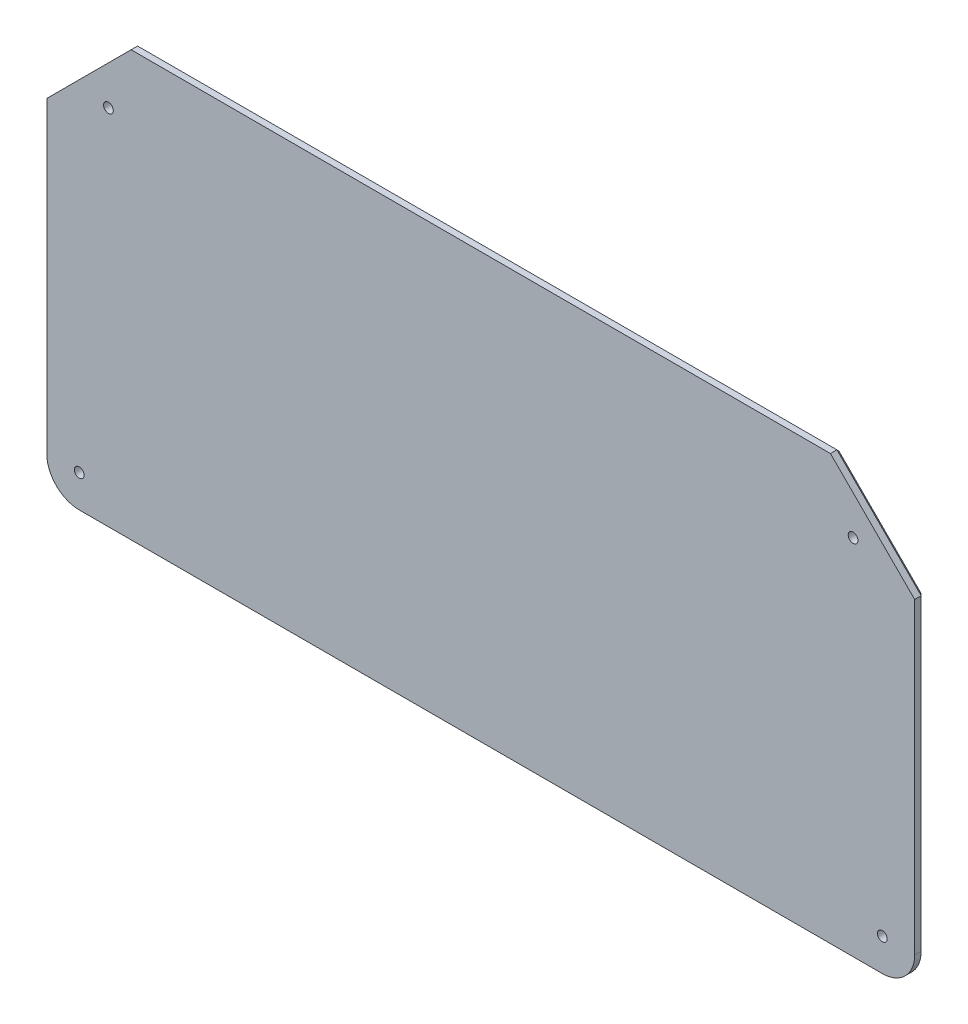
from build123d import *

# Parameters (mm, degrees)
BOSS_EXTRUDE1_DEPTH   = 3
F_3_0MM_DOWEL_HOLE1_D = 3
CHAMFER1_SIZE         = 1


with BuildPart() as part:
    # Sketch2 → Boss-Extrude1 (new body)
    with BuildSketch(Plane.XY):
        with BuildLine():
            Line((6.41186441, 110.238694526), (6.41186441, 15.286374556))
            ThreePointArc((6.41186441, 15.286374556), (9.340796598, 8.215306744), (16.41186441, 5.286374556))
            Line((16.41186441, 5.286374556), (264.168886442, 5.286374556))
            ThreePointArc((264.168886442, 5.286374556), (271.239954254, 8.215306744), (274.168886442, 15.286374556))
            Line((274.168886442, 15.286374556), (274.168886442, 110.238694526))
            Line((274.168886442, 110.238694526), (248.168886442, 136.238694526))
            Line((248.168886442, 136.238694526), (32.41186441, 136.238694526))
            Line((32.41186441, 136.238694526), (6.41186441, 110.238694526))
        make_face()
    extrude(amount=-BOSS_EXTRUDE1_DEPTH)

    # Ø3.0mm Dowel Hole1 (through all)
    with Locations(Plane.XY):
        with Locations((16.41186441, 15.286374556), (25.42227205, 117.228286886), (255.158478802, 117.228286886), (264.168886442, 15.286374556)):
            Hole(F_3_0MM_DOWEL_HOLE1_D / 2)

    # Chamfer1
    chamfer1_edges = [part.edges().sort_by_distance(p)[0] for p in [
        (6.41186441, 62.762534541, -3),
        (9.340796598, 8.215306744, -3),
        (140.290375426, 5.286374556, -3),
        (271.239954254, 8.215306744, -3),
        (19.41186441, 123.238694526, -3),
        (274.168886442, 62.762534541, -3),
        (261.168886442, 123.238694526, -3),
        (140.290375426, 136.238694526, -3),
    ]]
    chamfer(chamfer1_edges, length=CHAMFER1_SIZE)


solid = part.part
